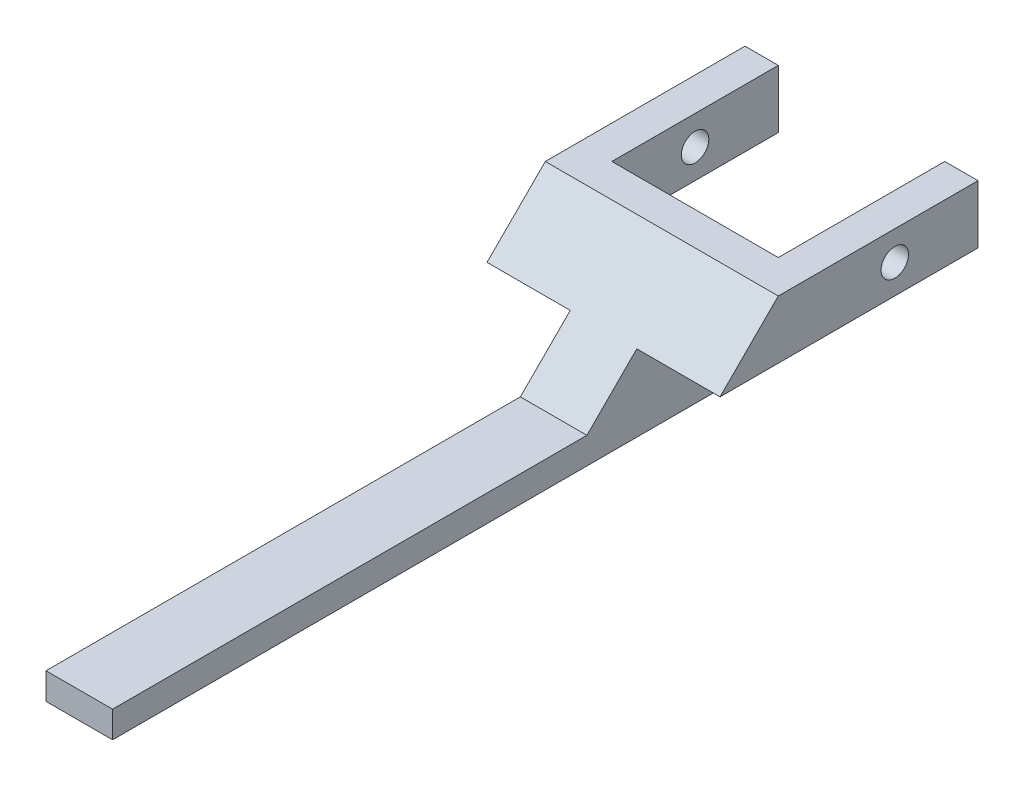
from build123d import *

# Parameters (mm, degrees)
SKETCH1_W             = 4
SKETCH1_H             = 7
BOSS_EXTRUDE1_DEPTH   = 24
BOSS_EXTRUDE1_2_DEPTH = 24
BOSS_EXTRUDE2_START   = 20
SKETCH1_3_W           = 20
SKETCH1_3_H           = 7
BOSS_EXTRUDE2_DEPTH   = 4
SKETCH2_W             = 8
SKETCH2_H             = 2.193366053
BOSS_EXTRUDE3_DEPTH   = 70
SKETCH3_W             = 8
SKETCH3_H             = 8.193366053
BOSS_EXTRUDE4_DEPTH   = 4
CUT_EXTRUDE1_REACH    = 100.423
SKETCH4_R             = 1.65
CHAMFER1_SIZE         = 13
SKETCH5_W             = 8
SKETCH5_H             = 74
BOSS_EXTRUDE5_DEPTH   = 1


with BuildPart() as part:
    # Sketch1 → Boss-Extrude1 (new body)
    with BuildSketch(Plane.XY):
        with Locations((-2, 3.5)):
            Rectangle(SKETCH1_W, SKETCH1_H)
    extrude(amount=BOSS_EXTRUDE1_DEPTH)



with BuildPart() as body_2:
    # Sketch1 → Boss-Extrude1 2 (new body)
    with BuildSketch(Plane.XY):
        with Locations((22, 3.5)):
            Rectangle(SKETCH1_W, SKETCH1_H)
    extrude(amount=BOSS_EXTRUDE1_2_DEPTH)


with BuildPart() as part_1:
    add(part.part)

    add(body_2.part)  # Boss-Extrude2 merges body 2
    # Sketch1<3> → Boss-Extrude2 (add)
    with BuildSketch(Plane.XY.offset(BOSS_EXTRUDE2_START)):
        with Locations((10, 3.5)):
            Rectangle(SKETCH1_3_W, SKETCH1_3_H)
    extrude(amount=BOSS_EXTRUDE2_DEPTH)



with BuildPart() as body_2_2:
    # Sketch2 → Boss-Extrude3 (new body)
    with BuildSketch(Plane.XY.offset(24)):
        with Locations((10, -7.096683027)):
            Rectangle(SKETCH2_W, SKETCH2_H)
    extrude(amount=BOSS_EXTRUDE3_DEPTH)


with BuildPart() as part_2:
    add(part_1.part)

    add(body_2_2.part)  # Boss-Extrude4 merges body 2 2
    # Sketch3 → Boss-Extrude4 (add)
    with BuildSketch(Plane(origin=(0, 0, 24), x_dir=(-1, 0, 0), z_dir=(0, 0, -1))):
        with Locations((-10, -4.096683027)):
            Rectangle(SKETCH3_W, SKETCH3_H)
    extrude(amount=BOSS_EXTRUDE4_DEPTH)

    # Cut-Extrude1: up to this face of the body (flat: up to its plane)
    cut_extrude1_end = Plane(part_2.part.faces().sort_by_distance((-4, 3.5, 12))[0])
    # Sketch4 → Cut-Extrude1 (cut, up to the picked face)
    with BuildSketch(Plane(origin=(24, 0, 0), x_dir=(0, 0, -1), z_dir=(1, 0, 0)), mode=Mode.PRIVATE) as cut_extrude1_sk1:
        with Locations((-10, 3.5)):
            Circle(SKETCH4_R)
    cut_extrude1_tool1 = split(extrude(cut_extrude1_sk1.sketch, amount=-CUT_EXTRUDE1_REACH, mode=Mode.PRIVATE), bisect_by=cut_extrude1_end, keep=Keep.BOTH, mode=Mode.PRIVATE)
    add(cut_extrude1_tool1.solids().sort_by(Axis((24, 3.5, 10), (-1, 0, 0)))[0], mode=Mode.SUBTRACT)

    # Chamfer1
    chamfer1_edges = [part_2.edges().sort_by_distance(p)[0] for p in [
        (10, -6, 24),
    ]]
    chamfer(chamfer1_edges, length=CHAMFER1_SIZE - 0.0001)  # a hair under: the kernel refuses the full size

    # Sketch5 → Boss-Extrude5 (add)
    with BuildSketch(Plane.XZ.offset(8.193366053)):
        with Locations((10, 57)):
            Rectangle(SKETCH5_W, SKETCH5_H)
    extrude(amount=BOSS_EXTRUDE5_DEPTH)


solid = part_2.part
